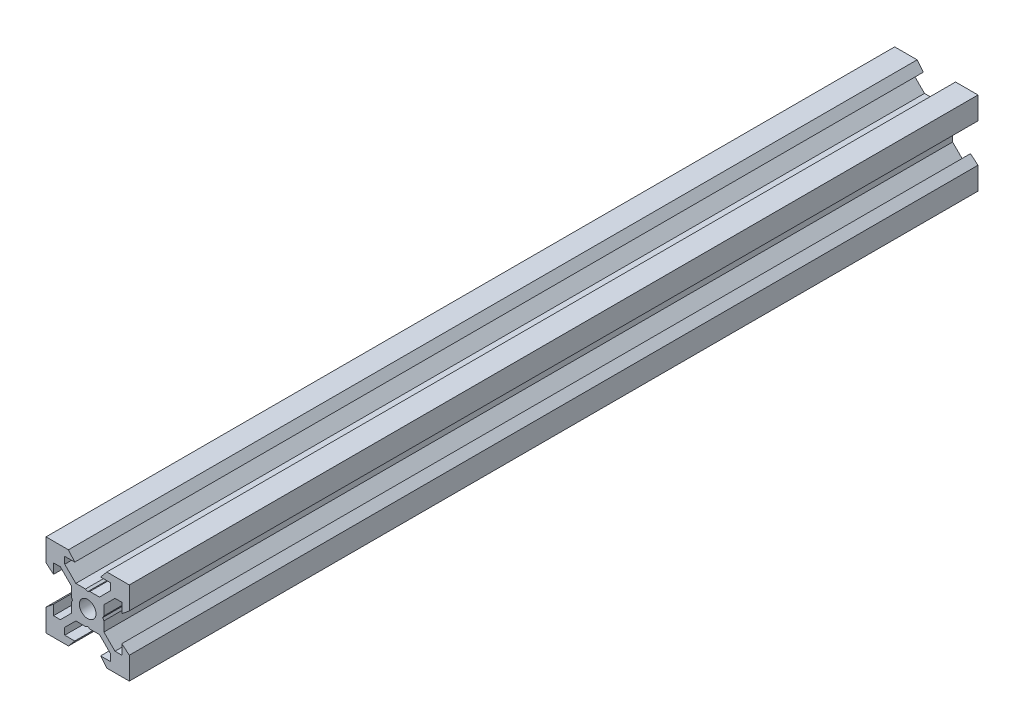
from build123d import *

# Parameters (mm, degrees)
SKETCH1_R           = 2
BOSS_EXTRUDE1_DEPTH = 101.87


with BuildPart() as part:
    # Sketch1 → Boss-Extrude1 (new, symmetric)
    with BuildSketch(Plane.XY):
        Polygon((10, 4.610379336), (10, 10), (4.610379336, 10), (3.1, 8.2), (5.5, 8.2), (5.5, 6.560660172), (2.839339828, 3.9), (0.519615242, 3.9), (0, 3.6), (-0.519615242, 3.9), (-2.839339828, 3.9), (-5.5, 6.560660172), (-5.5, 8.2), (-3.1, 8.2), (-4.610379336, 10), (-10, 10), (-10, 4.610379336), (-8.2, 3.1), (-8.2, 5.5), (-6.560660172, 5.5), (-3.9, 2.839339828), (-3.9, 0.519615242), (-3.6, 0), (-3.9, -0.519615242), (-3.9, -2.839339828), (-6.560660172, -5.5), (-8.2, -5.5), (-8.2, -3.1), (-10, -4.610379336), (-10, -10), (-4.610379336, -10), (-3.1, -8.2), (-5.5, -8.2), (-5.5, -6.560660172), (-2.839339828, -3.9), (-0.519615242, -3.9), (0, -3.6), (0.519615242, -3.9), (2.839339828, -3.9), (5.5, -6.560660172), (5.5, -8.2), (3.1, -8.2), (4.610379336, -10), (10, -10), (10, -4.610379336), (8.2, -3.1), (8.2, -5.5), (6.560660172, -5.5), (3.9, -2.839339828), (3.9, -0.519615242), (3.6, 0), (3.9, 0.519615242), (3.9, 2.839339828), (6.560660172, 5.5), (8.2, 5.5), (8.2, 3.1), align=None)
        Circle(SKETCH1_R, mode=Mode.SUBTRACT)
    extrude(amount=BOSS_EXTRUDE1_DEPTH, both=True)


solid = part.part
